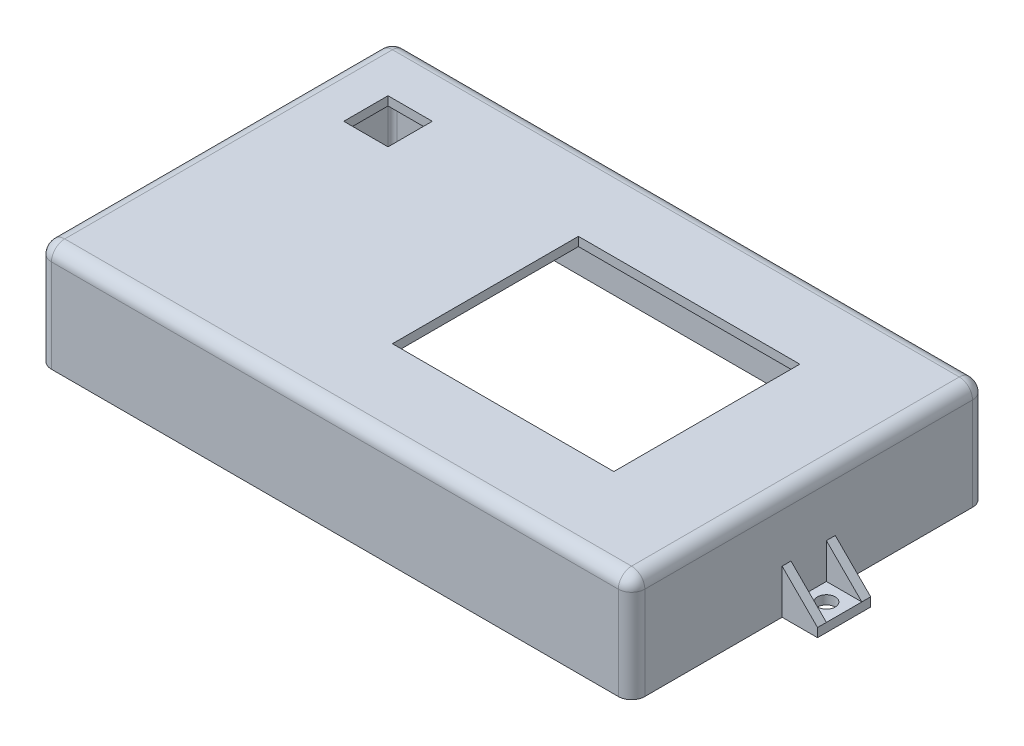
from build123d import *

# Parameters (mm, degrees)
SKETCH_1_W          = 134
SKETCH_1_H          = 80
EXTRUDE_352_DEPTH   = 24
FILLET_1_R          = 3
SHELL_1_T           = -2
SKETCH_2_W          = 50
SKETCH_2_H          = 42
SKETCH_2_W_2        = 10
SKETCH_2_H_2        = 10
CUT_EXTRUDE_1_DEPTH = 2
SKETCH_3_W          = 8
SKETCH_3_H          = 12
SKETCH_3_R          = 2
EXTRUDE_1169_DEPTH  = 2
SKETCH_4_W          = 8
SKETCH_4_H          = 2
EXTRUDE_3_DEPTH     = 8
SKETCH_5_W          = 8
SKETCH_5_H          = 2
EXTRUDE_4_DEPTH     = 8
CHAMFER_1_SIZE      = 8
SKETCH_6_W          = 10
SKETCH_6_H          = 2
EXTRUDE_5_DEPTH     = 4


with BuildPart() as part:
    # Эскиз1 → Extrude 352 (new body)
    with BuildSketch(Plane(origin=(0, 0, 0), x_dir=(1, 0, 0), z_dir=(0, 1, 0))):
        Rectangle(SKETCH_1_W, SKETCH_1_H)
    extrude(amount=EXTRUDE_352_DEPTH)

    # Скругление1
    fillet_1_edges = [part.edges().sort_by_distance(p)[0] for p in [
        (67, 24, 0),
        (0, 24, -40),
        (-67, 24, 0),
        (0, 24, 40),
        (-67, 12, -40),
        (67, 12, -40),
        (67, 12, 40),
        (-67, 12, 40),
    ]]
    fillet(fillet_1_edges, radius=FILLET_1_R)

    # Оболочка1
    shell_1_openings = [part.faces().sort_by_distance(p)[0] for p in [
        (0, 0, 0),
    ]]
    offset(amount=SHELL_1_T, openings=shell_1_openings, kind=Kind.INTERSECTION)

    # Эскиз2 → Вырез-Вытянуть1 (cut)
    with BuildSketch(Plane(origin=(0, 24, 0), x_dir=(1, 0, 0), z_dir=(0, 1, 0))):
        with Locations((18.5, 0.5)):
            Rectangle(SKETCH_2_W, SKETCH_2_H)
        with Locations((-50.5, 22.5)):
            Rectangle(SKETCH_2_W_2, SKETCH_2_H_2)
    extrude(amount=-CUT_EXTRUDE_1_DEPTH, mode=Mode.SUBTRACT)

    # Эскиз3 → Extrude 1169 (add)
    # profile 1 of 2: a face of its own
    with BuildSketch(Plane(origin=(0, 0, 0), x_dir=(1, 0, 0), z_dir=(0, 1, 0))):
        with Locations((-71, 0)):
            Rectangle(SKETCH_3_W, SKETCH_3_H)
        with Locations(Location((-71, 0, 0), (0, 0, 270))):
            Circle(SKETCH_3_R, mode=Mode.SUBTRACT)
    # profile 2 of 2: a face of its own
    with BuildSketch(Plane(origin=(0, 0, 0), x_dir=(1, 0, 0), z_dir=(0, 1, 0))):
        with Locations((71, 0)):
            Rectangle(SKETCH_3_W, SKETCH_3_H)
        with Locations(Location((71, 0, 0), (0, 0, 270))):
            Circle(SKETCH_3_R, mode=Mode.SUBTRACT)
    extrude(amount=EXTRUDE_1169_DEPTH)

    # Эскиз4 → Бобышка-Вытянуть3 (add)
    with BuildSketch(Plane(origin=(0, 2, 0), x_dir=(1, 0, 0), z_dir=(0, 1, 0))):
        with Locations((-71, 5)):
            Rectangle(SKETCH_4_W, SKETCH_4_H)
        with Locations((-71, -5)):
            Rectangle(SKETCH_4_W, SKETCH_4_H)
    extrude(amount=EXTRUDE_3_DEPTH)

    # Эскиз5 → Бобышка-Вытянуть4 (add)
    with BuildSketch(Plane(origin=(0, 2, 0), x_dir=(1, 0, 0), z_dir=(0, 1, 0))):
        with Locations((71, 5)):
            Rectangle(SKETCH_5_W, SKETCH_5_H)
        with Locations((71, -5)):
            Rectangle(SKETCH_5_W, SKETCH_5_H)
    extrude(amount=EXTRUDE_4_DEPTH)

    # Фаска1
    chamfer_1_edges = [part.edges().sort_by_distance(p)[0] for p in [
        (75, 10, 5),
        (75, 10, -5),
        (-75, 10, 5),
        (-75, 10, -5),
    ]]
    chamfer(chamfer_1_edges, length=CHAMFER_1_SIZE - 0.0001)  # a hair under: the kernel refuses the full size

    # Эскиз6 → Бобышка-Вытянуть5 (add)
    with BuildSketch(Plane.XZ.offset(-22)):
        with Locations((-50.5, -14)):
            Rectangle(SKETCH_6_W, SKETCH_6_H)
    extrude(amount=EXTRUDE_5_DEPTH)


solid = part.part
